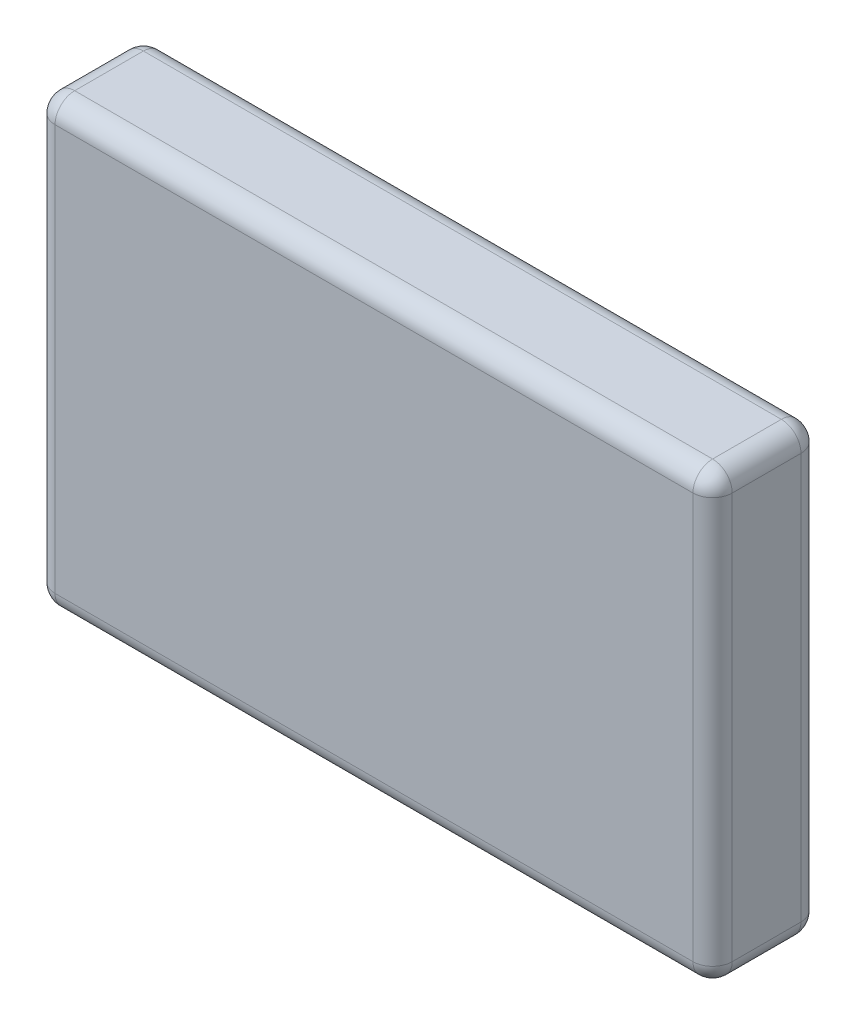
from build123d import *

# Parameters (mm, degrees)
SKETCH1_W           = 206.9
SKETCH1_H           = 136
BOSS_EXTRUDE1_DEPTH = 33
FILLET1_R           = 6
SKETCH2_W           = 16
SKETCH2_H           = 29.32636367
CUT_EXTRUDE1_DEPTH  = 36
SKETCH3_R           = 3.25
CUT_EXTRUDE2_DEPTH  = 36
SKETCH4_R           = 8
CUT_EXTRUDE3_DEPTH  = 36


with BuildPart() as part:
    # Sketch1 → Boss-Extrude1 (new body)
    with BuildSketch(Plane.XY):
        Rectangle(SKETCH1_W, SKETCH1_H)
    extrude(amount=BOSS_EXTRUDE1_DEPTH)

    # Fillet1
    fillet1_edges = [part.edges().sort_by_distance(p)[0] for p in [
        (0, -68, 33),
        (-103.45, 0, 33),
        (0, 68, 33),
        (103.45, 0, 33),
        (103.45, 0, 0),
        (0, 68, 0),
        (0, -68, 0),
        (-103.45, 0, 0),
        (-103.45, 68, 16.5),
        (103.45, 68, 16.5),
        (103.45, -68, 16.5),
        (-103.45, -68, 16.5),
    ]]
    fillet(fillet1_edges, radius=FILLET1_R)

    # Sketch2 → Cut-Extrude1 (cut)
    with BuildSketch(Plane.ZY.offset(103.45)):
        with Locations((15, -44.663181835)):
            Rectangle(SKETCH2_W, SKETCH2_H)
    extrude(amount=-CUT_EXTRUDE1_DEPTH, mode=Mode.SUBTRACT)

    # Sketch3 → Cut-Extrude2 (cut)
    with BuildSketch(Plane.ZY.offset(103.45)):
        with Locations((16.75, -17.5)):
            Circle(SKETCH3_R)
    extrude(amount=-CUT_EXTRUDE2_DEPTH, mode=Mode.SUBTRACT)

    # Sketch4 → Cut-Extrude3 (cut)
    with BuildSketch(Plane.ZY.offset(103.45)):
        with Locations((16.5, 20)):
            Circle(SKETCH4_R)
    extrude(amount=-CUT_EXTRUDE3_DEPTH, mode=Mode.SUBTRACT)


solid = part.part
